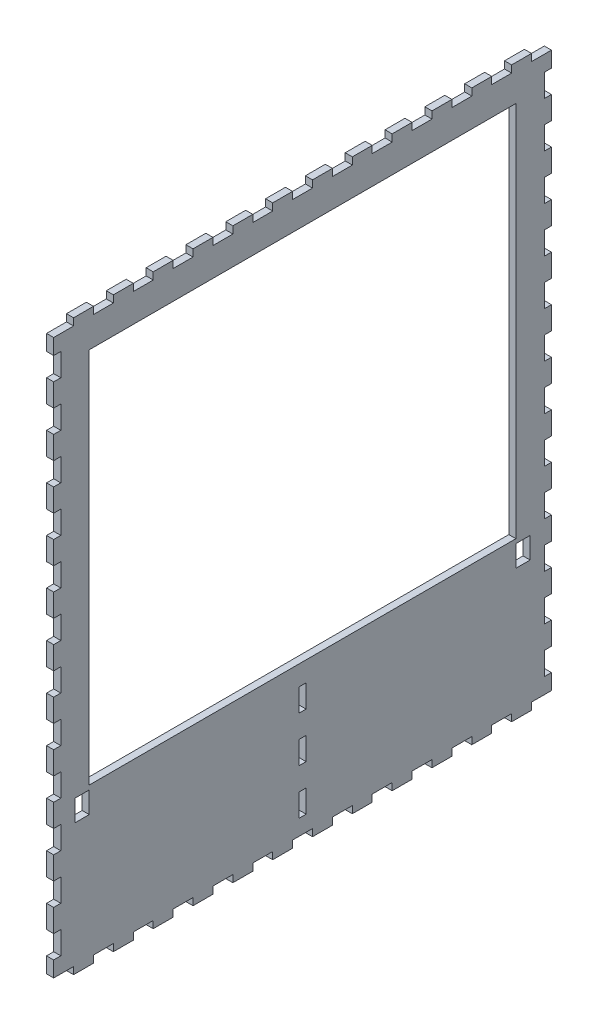
from build123d import *

# Parameters (mm, degrees)
ESQUISSE1_W                = 350
ESQUISSE1_H                = 400
BOSS_EXTRU_1_DEPTH         = 5
ESQUISSE2_W                = 14
ESQUISSE2_H                = 5
ENL_V_MAT_EXTRU_1_DEPTH    = 5
R_P_TITION_LIN_AIRE1_COUNT = 13
R_P_TITION_LIN_AIRE1_PITCH = 28
SYM_TRIE1_COPY_1_SKETCH_W  = 14
SYM_TRIE1_COPY_1_SKETCH_H  = 5
SYM_TRIE1_COPY_1_DEPTH     = 5
SYM_TRIE1_COPY_2_SKETCH_W  = 14
SYM_TRIE1_COPY_2_SKETCH_H  = 5
SYM_TRIE1_COPY_2_DEPTH     = 5
SYM_TRIE1_COPY_3_SKETCH_W  = 14
SYM_TRIE1_COPY_3_SKETCH_H  = 5
SYM_TRIE1_COPY_3_DEPTH     = 5
SYM_TRIE1_COPY_4_SKETCH_W  = 14
SYM_TRIE1_COPY_4_SKETCH_H  = 5
SYM_TRIE1_COPY_4_DEPTH     = 5
SYM_TRIE1_COPY_5_SKETCH_W  = 14
SYM_TRIE1_COPY_5_SKETCH_H  = 5
SYM_TRIE1_COPY_5_DEPTH     = 5
SYM_TRIE1_COPY_6_SKETCH_W  = 14
SYM_TRIE1_COPY_6_SKETCH_H  = 5
SYM_TRIE1_COPY_6_DEPTH     = 5
SYM_TRIE1_COPY_7_SKETCH_W  = 14
SYM_TRIE1_COPY_7_SKETCH_H  = 5
SYM_TRIE1_COPY_7_DEPTH     = 5
SYM_TRIE1_COPY_8_SKETCH_W  = 14
SYM_TRIE1_COPY_8_SKETCH_H  = 5
SYM_TRIE1_COPY_8_DEPTH     = 5
SYM_TRIE1_COPY_9_SKETCH_W  = 14
SYM_TRIE1_COPY_9_SKETCH_H  = 5
SYM_TRIE1_COPY_9_DEPTH     = 5
SYM_TRIE1_COPY_10_SKETCH_W = 14
SYM_TRIE1_COPY_10_SKETCH_H = 5
SYM_TRIE1_COPY_10_DEPTH    = 5
SYM_TRIE1_COPY_11_SKETCH_W = 14
SYM_TRIE1_COPY_11_SKETCH_H = 5
SYM_TRIE1_COPY_11_DEPTH    = 5
SYM_TRIE1_COPY_12_SKETCH_W = 14
SYM_TRIE1_COPY_12_SKETCH_H = 5
SYM_TRIE1_COPY_12_DEPTH    = 5
SYM_TRIE1_COPY_13_SKETCH_W = 14
SYM_TRIE1_COPY_13_SKETCH_H = 5
SYM_TRIE1_COPY_13_DEPTH    = 5
ESQUISSE3_W                = 5
ESQUISSE3_H                = 16
ENL_V_MAT_EXTRU_2_DEPTH    = 5
R_P_TITION_LIN_AIRE2_COUNT = 12
R_P_TITION_LIN_AIRE2_PITCH = 32
SYM_TRIE2_COPY_1_SKETCH_W  = 5
SYM_TRIE2_COPY_1_SKETCH_H  = 16
SYM_TRIE2_COPY_1_DEPTH     = 5
SYM_TRIE2_COPY_2_SKETCH_W  = 5
SYM_TRIE2_COPY_2_SKETCH_H  = 16
SYM_TRIE2_COPY_2_DEPTH     = 5
SYM_TRIE2_COPY_3_SKETCH_W  = 5
SYM_TRIE2_COPY_3_SKETCH_H  = 16
SYM_TRIE2_COPY_3_DEPTH     = 5
SYM_TRIE2_COPY_4_SKETCH_W  = 5
SYM_TRIE2_COPY_4_SKETCH_H  = 16
SYM_TRIE2_COPY_4_DEPTH     = 5
SYM_TRIE2_COPY_5_SKETCH_W  = 5
SYM_TRIE2_COPY_5_SKETCH_H  = 16
SYM_TRIE2_COPY_5_DEPTH     = 5
SYM_TRIE2_COPY_6_SKETCH_W  = 5
SYM_TRIE2_COPY_6_SKETCH_H  = 16
SYM_TRIE2_COPY_6_DEPTH     = 5
SYM_TRIE2_COPY_7_SKETCH_W  = 5
SYM_TRIE2_COPY_7_SKETCH_H  = 16
SYM_TRIE2_COPY_7_DEPTH     = 5
SYM_TRIE2_COPY_8_SKETCH_W  = 5
SYM_TRIE2_COPY_8_SKETCH_H  = 16
SYM_TRIE2_COPY_8_DEPTH     = 5
SYM_TRIE2_COPY_9_SKETCH_W  = 5
SYM_TRIE2_COPY_9_SKETCH_H  = 16
SYM_TRIE2_COPY_9_DEPTH     = 5
SYM_TRIE2_COPY_10_SKETCH_W = 5
SYM_TRIE2_COPY_10_SKETCH_H = 16
SYM_TRIE2_COPY_10_DEPTH    = 5
SYM_TRIE2_COPY_11_SKETCH_W = 5
SYM_TRIE2_COPY_11_SKETCH_H = 16
SYM_TRIE2_COPY_11_DEPTH    = 5
SYM_TRIE2_COPY_12_SKETCH_W = 5
SYM_TRIE2_COPY_12_SKETCH_H = 16
SYM_TRIE2_COPY_12_DEPTH    = 5
ESQUISSE4_W                = 300
ESQUISSE4_H                = 265
ENL_V_MAT_EXTRU_3_DEPTH    = 5
ESQUISSE5_W                = 10
ESQUISSE5_H                = 15
ENL_V_MAT_EXTRU_4_DEPTH    = 5
ESQUISSE6_W                = 5
ESQUISSE6_H                = 16
ENL_V_MAT_EXTRU_5_DEPTH    = 5
R_P_TITION_LIN_AIRE3_COUNT = 3
R_P_TITION_LIN_AIRE3_PITCH = 32


with BuildPart() as part:
    # Esquisse1 → Boss.-Extru.1 (new body)
    with BuildSketch(Plane(origin=(0, 0, 0), x_dir=(0, 0, -1), z_dir=(1, 0, 0))):
        with Locations((175, -200)):
            Rectangle(ESQUISSE1_W, ESQUISSE1_H)
    extrude(amount=BOSS_EXTRU_1_DEPTH)

    # Esquisse2 → Enlèv. mat.-Extru.1 (cut)
    with BuildSketch(Plane(origin=(5, 0, 0), x_dir=(0, 0, -1), z_dir=(1, 0, 0))):
        with Locations((343, -397.5)):
            Rectangle(ESQUISSE2_W, ESQUISSE2_H)
    enl_v_mat_extru_1 = extrude(amount=-ENL_V_MAT_EXTRU_1_DEPTH, mode=Mode.SUBTRACT)

    # Répétition linéaire1: Enlèv. mat.-Extru.1 ×13
    with Locations(*[(0, 0, i * R_P_TITION_LIN_AIRE1_PITCH) for i in range(1, R_P_TITION_LIN_AIRE1_COUNT)]):
        add(enl_v_mat_extru_1, mode=Mode.SUBTRACT)

    # Symétrie1 copy 1 sketch → Symétrie1 copy 1 (cut)
    with BuildSketch(Plane(origin=(5, -400, 28), x_dir=(0, 0, -1), z_dir=(1, 0, 0))):
        with Locations((343, 397.5)):
            Rectangle(SYM_TRIE1_COPY_1_SKETCH_W, SYM_TRIE1_COPY_1_SKETCH_H)
    extrude(amount=-SYM_TRIE1_COPY_1_DEPTH, mode=Mode.SUBTRACT)

    # Symétrie1 copy 2 sketch → Symétrie1 copy 2 (cut)
    with BuildSketch(Plane(origin=(5, -400, 56), x_dir=(0, 0, -1), z_dir=(1, 0, 0))):
        with Locations((343, 397.5)):
            Rectangle(SYM_TRIE1_COPY_2_SKETCH_W, SYM_TRIE1_COPY_2_SKETCH_H)
    extrude(amount=-SYM_TRIE1_COPY_2_DEPTH, mode=Mode.SUBTRACT)

    # Symétrie1 copy 3 sketch → Symétrie1 copy 3 (cut)
    with BuildSketch(Plane(origin=(5, -400, 84), x_dir=(0, 0, -1), z_dir=(1, 0, 0))):
        with Locations((343, 397.5)):
            Rectangle(SYM_TRIE1_COPY_3_SKETCH_W, SYM_TRIE1_COPY_3_SKETCH_H)
    extrude(amount=-SYM_TRIE1_COPY_3_DEPTH, mode=Mode.SUBTRACT)

    # Symétrie1 copy 4 sketch → Symétrie1 copy 4 (cut)
    with BuildSketch(Plane(origin=(5, -400, 112), x_dir=(0, 0, -1), z_dir=(1, 0, 0))):
        with Locations((343, 397.5)):
            Rectangle(SYM_TRIE1_COPY_4_SKETCH_W, SYM_TRIE1_COPY_4_SKETCH_H)
    extrude(amount=-SYM_TRIE1_COPY_4_DEPTH, mode=Mode.SUBTRACT)

    # Symétrie1 copy 5 sketch → Symétrie1 copy 5 (cut)
    with BuildSketch(Plane(origin=(5, -400, 140), x_dir=(0, 0, -1), z_dir=(1, 0, 0))):
        with Locations((343, 397.5)):
            Rectangle(SYM_TRIE1_COPY_5_SKETCH_W, SYM_TRIE1_COPY_5_SKETCH_H)
    extrude(amount=-SYM_TRIE1_COPY_5_DEPTH, mode=Mode.SUBTRACT)

    # Symétrie1 copy 6 sketch → Symétrie1 copy 6 (cut)
    with BuildSketch(Plane(origin=(5, -400, 168), x_dir=(0, 0, -1), z_dir=(1, 0, 0))):
        with Locations((343, 397.5)):
            Rectangle(SYM_TRIE1_COPY_6_SKETCH_W, SYM_TRIE1_COPY_6_SKETCH_H)
    extrude(amount=-SYM_TRIE1_COPY_6_DEPTH, mode=Mode.SUBTRACT)

    # Symétrie1 copy 7 sketch → Symétrie1 copy 7 (cut)
    with BuildSketch(Plane(origin=(5, -400, 196), x_dir=(0, 0, -1), z_dir=(1, 0, 0))):
        with Locations((343, 397.5)):
            Rectangle(SYM_TRIE1_COPY_7_SKETCH_W, SYM_TRIE1_COPY_7_SKETCH_H)
    extrude(amount=-SYM_TRIE1_COPY_7_DEPTH, mode=Mode.SUBTRACT)

    # Symétrie1 copy 8 sketch → Symétrie1 copy 8 (cut)
    with BuildSketch(Plane(origin=(5, -400, 224), x_dir=(0, 0, -1), z_dir=(1, 0, 0))):
        with Locations((343, 397.5)):
            Rectangle(SYM_TRIE1_COPY_8_SKETCH_W, SYM_TRIE1_COPY_8_SKETCH_H)
    extrude(amount=-SYM_TRIE1_COPY_8_DEPTH, mode=Mode.SUBTRACT)

    # Symétrie1 copy 9 sketch → Symétrie1 copy 9 (cut)
    with BuildSketch(Plane(origin=(5, -400, 252), x_dir=(0, 0, -1), z_dir=(1, 0, 0))):
        with Locations((343, 397.5)):
            Rectangle(SYM_TRIE1_COPY_9_SKETCH_W, SYM_TRIE1_COPY_9_SKETCH_H)
    extrude(amount=-SYM_TRIE1_COPY_9_DEPTH, mode=Mode.SUBTRACT)

    # Symétrie1 copy 10 sketch → Symétrie1 copy 10 (cut)
    with BuildSketch(Plane(origin=(5, -400, 280), x_dir=(0, 0, -1), z_dir=(1, 0, 0))):
        with Locations((343, 397.5)):
            Rectangle(SYM_TRIE1_COPY_10_SKETCH_W, SYM_TRIE1_COPY_10_SKETCH_H)
    extrude(amount=-SYM_TRIE1_COPY_10_DEPTH, mode=Mode.SUBTRACT)

    # Symétrie1 copy 11 sketch → Symétrie1 copy 11 (cut)
    with BuildSketch(Plane(origin=(5, -400, 308), x_dir=(0, 0, -1), z_dir=(1, 0, 0))):
        with Locations((343, 397.5)):
            Rectangle(SYM_TRIE1_COPY_11_SKETCH_W, SYM_TRIE1_COPY_11_SKETCH_H)
    extrude(amount=-SYM_TRIE1_COPY_11_DEPTH, mode=Mode.SUBTRACT)

    # Symétrie1 copy 12 sketch → Symétrie1 copy 12 (cut)
    with BuildSketch(Plane(origin=(5, -400, 336), x_dir=(0, 0, -1), z_dir=(1, 0, 0))):
        with Locations((343, 397.5)):
            Rectangle(SYM_TRIE1_COPY_12_SKETCH_W, SYM_TRIE1_COPY_12_SKETCH_H)
    extrude(amount=-SYM_TRIE1_COPY_12_DEPTH, mode=Mode.SUBTRACT)

    # Symétrie1 copy 13 sketch → Symétrie1 copy 13 (cut)
    with BuildSketch(Plane(origin=(5, -400, 0), x_dir=(0, 0, -1), z_dir=(1, 0, 0))):
        with Locations((343, 397.5)):
            Rectangle(SYM_TRIE1_COPY_13_SKETCH_W, SYM_TRIE1_COPY_13_SKETCH_H)
    extrude(amount=-SYM_TRIE1_COPY_13_DEPTH, mode=Mode.SUBTRACT)

    # Esquisse3 → Enlèv. mat.-Extru.2 (cut)
    with BuildSketch(Plane(origin=(5, 0, 0), x_dir=(0, 0, -1), z_dir=(1, 0, 0))):
        with Locations((347.5, -376)):
            Rectangle(ESQUISSE3_W, ESQUISSE3_H)
    enl_v_mat_extru_2 = extrude(amount=-ENL_V_MAT_EXTRU_2_DEPTH, mode=Mode.SUBTRACT)

    # Répétition linéaire2: Enlèv. mat.-Extru.2 ×12
    with Locations(*[(0, i * R_P_TITION_LIN_AIRE2_PITCH, 0) for i in range(1, R_P_TITION_LIN_AIRE2_COUNT)]):
        add(enl_v_mat_extru_2, mode=Mode.SUBTRACT)

    # Symétrie2 copy 1 sketch → Symétrie2 copy 1 (cut)
    with BuildSketch(Plane(origin=(5, 32, -350), x_dir=(0, 0, 1), z_dir=(1, 0, 0))):
        with Locations((347.5, 376)):
            Rectangle(SYM_TRIE2_COPY_1_SKETCH_W, SYM_TRIE2_COPY_1_SKETCH_H)
    extrude(amount=-SYM_TRIE2_COPY_1_DEPTH, mode=Mode.SUBTRACT)

    # Symétrie2 copy 2 sketch → Symétrie2 copy 2 (cut)
    with BuildSketch(Plane(origin=(5, 64, -350), x_dir=(0, 0, 1), z_dir=(1, 0, 0))):
        with Locations((347.5, 376)):
            Rectangle(SYM_TRIE2_COPY_2_SKETCH_W, SYM_TRIE2_COPY_2_SKETCH_H)
    extrude(amount=-SYM_TRIE2_COPY_2_DEPTH, mode=Mode.SUBTRACT)

    # Symétrie2 copy 3 sketch → Symétrie2 copy 3 (cut)
    with BuildSketch(Plane(origin=(5, 96, -350), x_dir=(0, 0, 1), z_dir=(1, 0, 0))):
        with Locations((347.5, 376)):
            Rectangle(SYM_TRIE2_COPY_3_SKETCH_W, SYM_TRIE2_COPY_3_SKETCH_H)
    extrude(amount=-SYM_TRIE2_COPY_3_DEPTH, mode=Mode.SUBTRACT)

    # Symétrie2 copy 4 sketch → Symétrie2 copy 4 (cut)
    with BuildSketch(Plane(origin=(5, 128, -350), x_dir=(0, 0, 1), z_dir=(1, 0, 0))):
        with Locations((347.5, 376)):
            Rectangle(SYM_TRIE2_COPY_4_SKETCH_W, SYM_TRIE2_COPY_4_SKETCH_H)
    extrude(amount=-SYM_TRIE2_COPY_4_DEPTH, mode=Mode.SUBTRACT)

    # Symétrie2 copy 5 sketch → Symétrie2 copy 5 (cut)
    with BuildSketch(Plane(origin=(5, 160, -350), x_dir=(0, 0, 1), z_dir=(1, 0, 0))):
        with Locations((347.5, 376)):
            Rectangle(SYM_TRIE2_COPY_5_SKETCH_W, SYM_TRIE2_COPY_5_SKETCH_H)
    extrude(amount=-SYM_TRIE2_COPY_5_DEPTH, mode=Mode.SUBTRACT)

    # Symétrie2 copy 6 sketch → Symétrie2 copy 6 (cut)
    with BuildSketch(Plane(origin=(5, 192, -350), x_dir=(0, 0, 1), z_dir=(1, 0, 0))):
        with Locations((347.5, 376)):
            Rectangle(SYM_TRIE2_COPY_6_SKETCH_W, SYM_TRIE2_COPY_6_SKETCH_H)
    extrude(amount=-SYM_TRIE2_COPY_6_DEPTH, mode=Mode.SUBTRACT)

    # Symétrie2 copy 7 sketch → Symétrie2 copy 7 (cut)
    with BuildSketch(Plane(origin=(5, 224, -350), x_dir=(0, 0, 1), z_dir=(1, 0, 0))):
        with Locations((347.5, 376)):
            Rectangle(SYM_TRIE2_COPY_7_SKETCH_W, SYM_TRIE2_COPY_7_SKETCH_H)
    extrude(amount=-SYM_TRIE2_COPY_7_DEPTH, mode=Mode.SUBTRACT)

    # Symétrie2 copy 8 sketch → Symétrie2 copy 8 (cut)
    with BuildSketch(Plane(origin=(5, 256, -350), x_dir=(0, 0, 1), z_dir=(1, 0, 0))):
        with Locations((347.5, 376)):
            Rectangle(SYM_TRIE2_COPY_8_SKETCH_W, SYM_TRIE2_COPY_8_SKETCH_H)
    extrude(amount=-SYM_TRIE2_COPY_8_DEPTH, mode=Mode.SUBTRACT)

    # Symétrie2 copy 9 sketch → Symétrie2 copy 9 (cut)
    with BuildSketch(Plane(origin=(5, 288, -350), x_dir=(0, 0, 1), z_dir=(1, 0, 0))):
        with Locations((347.5, 376)):
            Rectangle(SYM_TRIE2_COPY_9_SKETCH_W, SYM_TRIE2_COPY_9_SKETCH_H)
    extrude(amount=-SYM_TRIE2_COPY_9_DEPTH, mode=Mode.SUBTRACT)

    # Symétrie2 copy 10 sketch → Symétrie2 copy 10 (cut)
    with BuildSketch(Plane(origin=(5, 320, -350), x_dir=(0, 0, 1), z_dir=(1, 0, 0))):
        with Locations((347.5, 376)):
            Rectangle(SYM_TRIE2_COPY_10_SKETCH_W, SYM_TRIE2_COPY_10_SKETCH_H)
    extrude(amount=-SYM_TRIE2_COPY_10_DEPTH, mode=Mode.SUBTRACT)

    # Symétrie2 copy 11 sketch → Symétrie2 copy 11 (cut)
    with BuildSketch(Plane(origin=(5, 352, -350), x_dir=(0, 0, 1), z_dir=(1, 0, 0))):
        with Locations((347.5, 376)):
            Rectangle(SYM_TRIE2_COPY_11_SKETCH_W, SYM_TRIE2_COPY_11_SKETCH_H)
    extrude(amount=-SYM_TRIE2_COPY_11_DEPTH, mode=Mode.SUBTRACT)

    # Symétrie2 copy 12 sketch → Symétrie2 copy 12 (cut)
    with BuildSketch(Plane(origin=(5, 0, -350), x_dir=(0, 0, 1), z_dir=(1, 0, 0))):
        with Locations((347.5, 376)):
            Rectangle(SYM_TRIE2_COPY_12_SKETCH_W, SYM_TRIE2_COPY_12_SKETCH_H)
    extrude(amount=-SYM_TRIE2_COPY_12_DEPTH, mode=Mode.SUBTRACT)

    # Esquisse4 → Enlèv. mat.-Extru.3 (cut)
    with BuildSketch(Plane(origin=(5, 0, 0), x_dir=(0, 0, -1), z_dir=(1, 0, 0))):
        with Locations((175, -157.5)):
            Rectangle(ESQUISSE4_W, ESQUISSE4_H)
    extrude(amount=-ENL_V_MAT_EXTRU_3_DEPTH, mode=Mode.SUBTRACT)

    # Esquisse5 → Enlèv. mat.-Extru.4 (cut)
    with BuildSketch(Plane(origin=(5, 0, 0), x_dir=(0, 0, -1), z_dir=(1, 0, 0))):
        with Locations((330, -300.5)):
            Rectangle(ESQUISSE5_W, ESQUISSE5_H)
    enl_v_mat_extru_4 = extrude(amount=-ENL_V_MAT_EXTRU_4_DEPTH, mode=Mode.SUBTRACT)

    # Symétrie3: Enlèv. mat.-Extru.4 across plane
    add(enl_v_mat_extru_4.mirror(Plane(origin=(0, 0, -175), x_dir=(1, 0, 0), z_dir=(0, 0, -1))), mode=Mode.SUBTRACT)

    # Esquisse6 → Enlèv. mat.-Extru.5 (cut)
    with BuildSketch(Plane(origin=(5, 0, 0), x_dir=(0, 0, -1), z_dir=(1, 0, 0))):
        with Locations((175, -376)):
            Rectangle(ESQUISSE6_W, ESQUISSE6_H)
    enl_v_mat_extru_5 = extrude(amount=-ENL_V_MAT_EXTRU_5_DEPTH, mode=Mode.SUBTRACT)

    # Répétition linéaire3: Enlèv. mat.-Extru.5 ×3
    with Locations(*[(0, i * R_P_TITION_LIN_AIRE3_PITCH, 0) for i in range(1, R_P_TITION_LIN_AIRE3_COUNT)]):
        add(enl_v_mat_extru_5, mode=Mode.SUBTRACT)


solid = part.part
